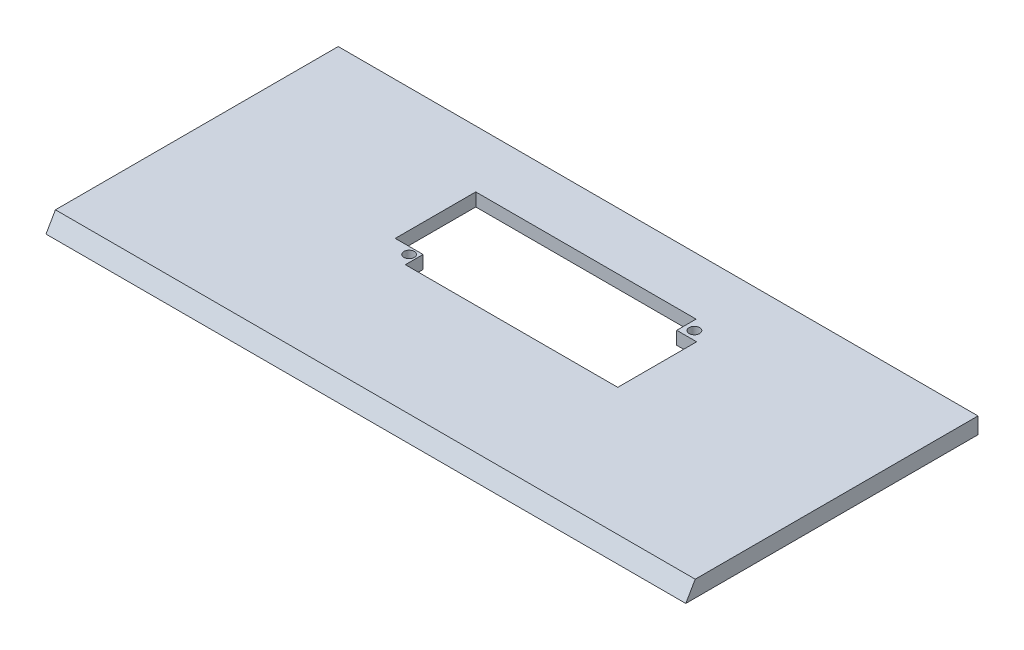
from build123d import *

# Parameters (mm, degrees)
SALIENTE_EXTRUIR1_DEPTH = 196
VACIADO1_T              = -4
SKETCH2_R               = 1.6
CUT_EXTRUDE1_DEPTH      = 4.9


with BuildPart() as part:
    # Croquis1 → Saliente-Extruir1 (new body)
    with BuildSketch(Plane(origin=(0, 0, 0), x_dir=(0, 0, -1), z_dir=(1, 0, 0))):
        Polygon((0, 0), (89.52, 0), (89.52, 5), (2.886751346, 5), align=None)
    extrude(amount=SALIENTE_EXTRUIR1_DEPTH)

    # Vaciado1
    vaciado1_openings = [part.faces().sort_by_distance(p)[0] for p in [
        (98, 0, -44.76),
    ]]
    offset(amount=VACIADO1_T, openings=vaciado1_openings, kind=Kind.INTERSECTION)

    # Sketch2 → Cut-Extrude1 (cut)
    with BuildSketch(Plane(origin=(0, 1, 0), x_dir=(-1, 0, 0), z_dir=(0, -1, 0))):
        with Locations((-66.016866124, 45.223012087)):
            Circle(SKETCH2_R)
        with Locations((-129.916866124, 68.723012087)):
            Circle(SKETCH2_R)
        Polygon((-59.63721676, 47.355101101), (-68.161474477, 47.355101101), (-68.161474477, 41.923012087), (-133.236866124, 41.923012087), (-133.236866124, 66.093328063), (-127.135158107, 66.093328063), (-127.135158107, 72.023012087), (-59.63721676, 72.023012087), align=None)
    extrude(amount=-CUT_EXTRUDE1_DEPTH, mode=Mode.SUBTRACT)


solid = part.part
